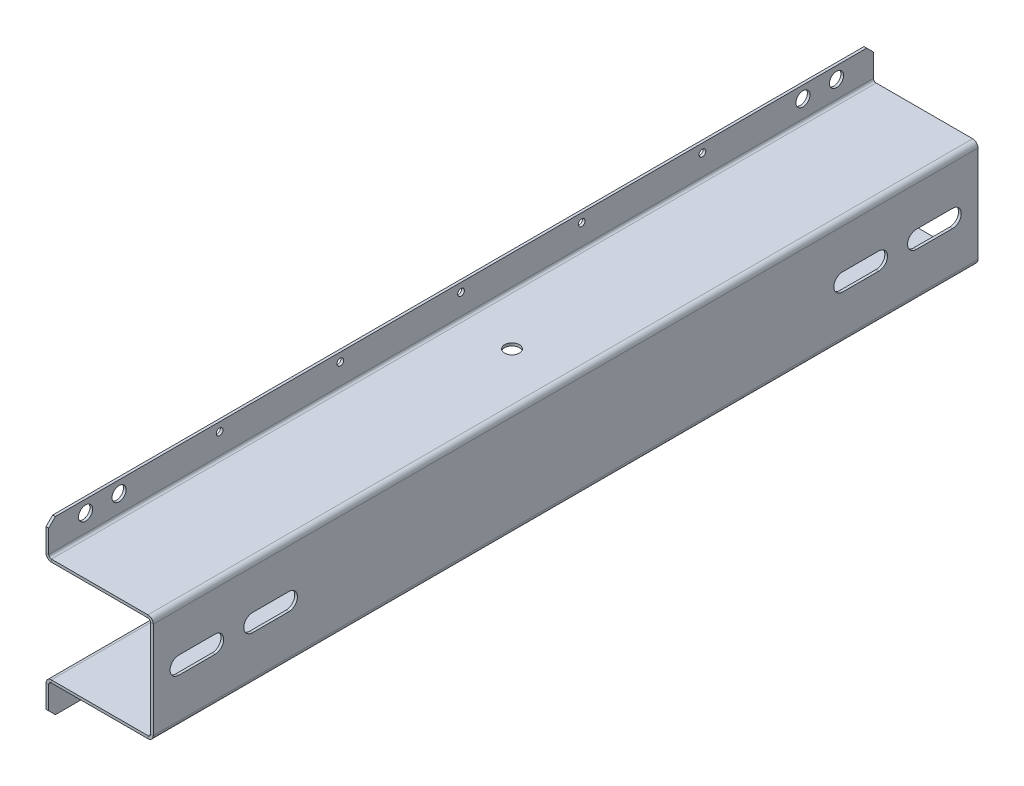
from build123d import *

# Parameters (mm, degrees)
SM_BASE_FLANGE_1_DEPTH = 307.5
SKETCH_6_R             = 5.25
SKETCH_6_R_2           = 2.5
CUT_EXTRUDE_1_DEPTH    = 10
CUT_EXTRUDE_2_DEPTH    = 10
SKETCH_9_R             = 5.5
CUT_EXTRUDE_4_DEPTH    = 334.850640257
CHAMFER_1_SIZE         = 5


# Sheet-metal steps are written as plain solids
with BuildPart() as part:
    # Sketch 1 → Базовая кромка1 (new, symmetric)
    with BuildSketch(Plane.XY):
        with BuildLine():
            Line((-78, 64), (-78, 42))
            ThreePointArc((-78, 42), (-76.828427125, 39.171572875), (-74, 38))
            Line((-74, 38), (-2, 38))
            ThreePointArc((-2, 38), (-0.585786438, 37.414213562), (0, 36))
            Line((0, 36), (0, -36))
            ThreePointArc((0, -36), (-0.585786438, -37.414213562), (-2, -38))
            Line((-2, -38), (-74, -38))
            ThreePointArc((-74, -38), (-76.828427125, -39.171572875), (-78, -42))
            Line((-78, -42), (-78, -64))
            Line((-78, -64), (-76, -64))
            Line((-76, -64), (-76, -42))
            ThreePointArc((-76, -42), (-75.414213562, -40.585786438), (-74, -40))
            Line((-74, -40), (-2, -40))
            ThreePointArc((-2, -40), (0.828427125, -38.828427125), (2, -36))
            Line((2, -36), (2, 36))
            ThreePointArc((2, 36), (0.828427125, 38.828427125), (-2, 40))
            Line((-2, 40), (-74, 40))
            ThreePointArc((-74, 40), (-75.414213562, 40.585786438), (-76, 42))
            Line((-76, 42), (-76, 64))
            Line((-76, 64), (-78, 64))
        make_face()
    extrude(amount=SM_BASE_FLANGE_1_DEPTH, both=True)

    # Эскиз6 → Вырез-Вытянуть1 (cut)
    with BuildSketch(Plane(origin=(-76, 0, 0), x_dir=(0, 0, -1), z_dir=(1, 0, 0))):
        with Locations(Location((280, 55, 0), (0, 0, 90))):
            Circle(SKETCH_6_R)
        with Locations(Location((255, 55, 0), (0, 0, 90))):
            Circle(SKETCH_6_R)
        with Locations(Location((180, 57.5, 0), (0, 0, 90))):
            Circle(SKETCH_6_R_2)
        with Locations(Location((90, 57.5, 0), (0, 0, 90))):
            Circle(SKETCH_6_R_2)
        with Locations(Location((0, 57.5, 0), (0, 0, 90))):
            Circle(SKETCH_6_R_2)
        with Locations(Location((-90, 57.5, 0), (0, 0, 270))):
            Circle(SKETCH_6_R_2)
        with Locations(Location((-180, 57.5, 0), (0, 0, 270))):
            Circle(SKETCH_6_R_2)
        with Locations(Location((-255, 55, 0), (0, 0, 270))):
            Circle(SKETCH_6_R)
        with Locations(Location((-280, 55, 0), (0, 0, 270))):
            Circle(SKETCH_6_R)
    cut_extrude_1 = extrude(amount=-CUT_EXTRUDE_1_DEPTH, mode=Mode.SUBTRACT)

    # Зеркальное отражение1: Вырез-Вытянуть1 across plane
    add(cut_extrude_1.mirror(Plane.ZX), mode=Mode.SUBTRACT)

    # Эскиз7 → Вырез-Вытянуть2 (cut)
    with BuildSketch(Plane(origin=(2, 0, 0), x_dir=(0, 0, -1), z_dir=(1, 0, 0))):
        with BuildLine():
            Line((-288.5, 6.5), (-261.5, 6.5))
            ThreePointArc((-261.5, 6.5), (-255, 0), (-261.5, -6.5))
            Line((-261.5, -6.5), (-288.5, -6.5))
            ThreePointArc((-288.5, -6.5), (-295, 0), (-288.5, 6.5))
        make_face()
        with BuildLine():
            Line((-233.5, 6.5), (-206.5, 6.5))
            ThreePointArc((-206.5, 6.5), (-200, 0), (-206.5, -6.5))
            Line((-206.5, -6.5), (-233.5, -6.5))
            ThreePointArc((-233.5, -6.5), (-240, 0), (-233.5, 6.5))
        make_face()
        with BuildLine():
            Line((288.5, 6.5), (261.5, 6.5))
            ThreePointArc((261.5, 6.5), (255, 0), (261.5, -6.5))
            Line((261.5, -6.5), (288.5, -6.5))
            ThreePointArc((288.5, -6.5), (295, 0), (288.5, 6.5))
        make_face()
        with BuildLine():
            Line((233.5, 6.5), (206.5, 6.5))
            ThreePointArc((206.5, 6.5), (200, 0), (206.5, -6.5))
            Line((206.5, -6.5), (233.5, -6.5))
            ThreePointArc((233.5, -6.5), (240, 0), (233.5, 6.5))
        make_face()
    extrude(amount=-CUT_EXTRUDE_2_DEPTH, mode=Mode.SUBTRACT)

    # Эскиз9 → Вырез-Вытянуть4 (cut, through all)
    with BuildSketch(Plane(origin=(0, 40, 0), x_dir=(1, 0, 0), z_dir=(0, 1, 0))):
        with Locations(Location((-38, 0, 0), (0, 0, 270))):
            Circle(SKETCH_9_R)
    extrude(amount=-CUT_EXTRUDE_4_DEPTH, mode=Mode.SUBTRACT)

    # Фаска1
    chamfer_1_edges = [part.edges().sort_by_distance(p)[0] for p in [
        (-77, -64, -307.5),
        (-77, 64, -307.5),
        (-77, -64, 307.5),
        (-77, 64, 307.5),
    ]]
    chamfer(chamfer_1_edges, length=CHAMFER_1_SIZE)


solid = part.part
